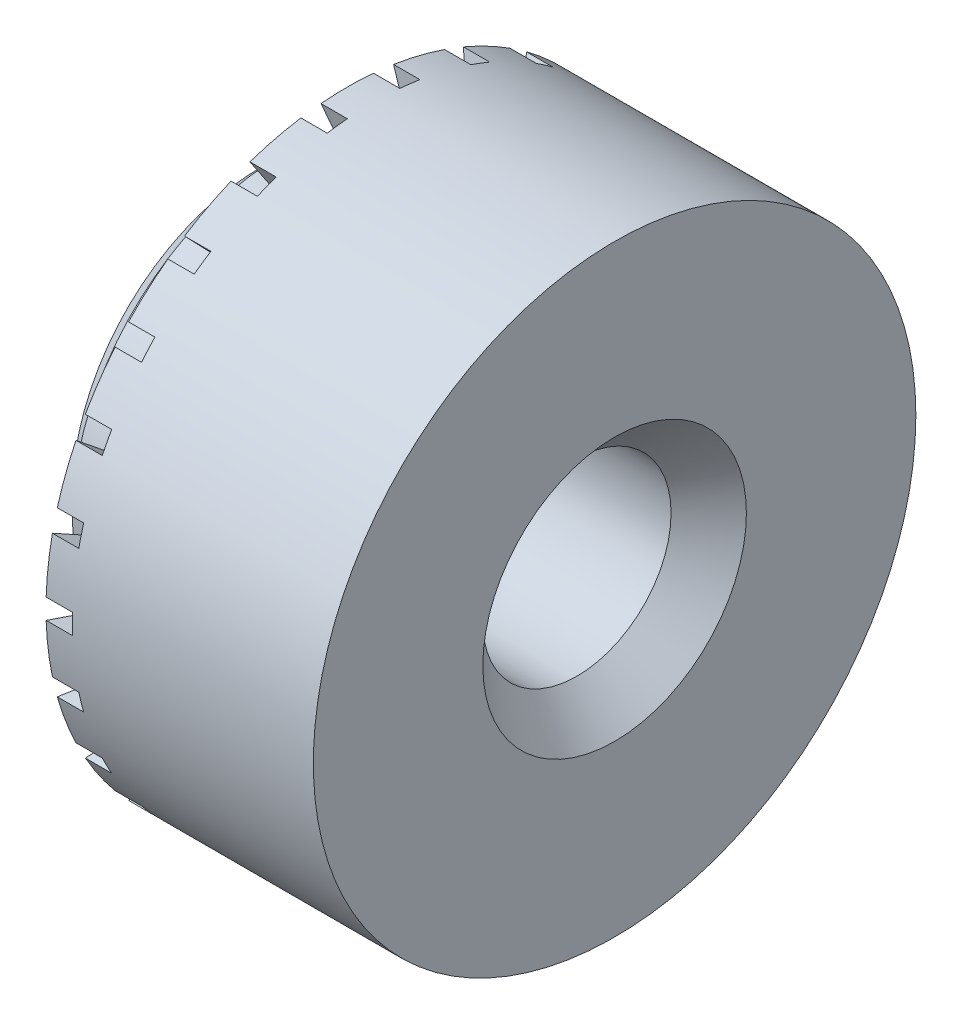
from build123d import *

# Parameters (mm, degrees)
SKETCH_1_R               = 4
EXTRUDE_1_DEPTH          = 3.2
SKETCH_2_R               = 2.75
EXTRUDE_2_DEPTH          = 1.5
SKETCH_3_R               = 1.25
CUT_EXTRUDE_1_DEPTH      = 8.354590403
CHAMFER_1_SIZE           = 0.5
CHAMFER_2_SIZE           = 0.25
REVOLVE_1_ANGLE          = 10
CUT_EXTRUDE_3_DEPTH      = 7.499230724
PATTERN_CIRCULAR_1_COUNT = 26


# Read off the part's stored shape, not the designer's step: Повернуть1
with BuildPart() as part:
    # Эскиз1 → Вытянуть1 (new body)
    with BuildSketch(Plane(origin=(0, 0, 0), x_dir=(0, 0, -1), z_dir=(1, 0, 0))):
        Circle(SKETCH_1_R)
    extrude(amount=EXTRUDE_1_DEPTH)

    # Эскиз2 → Вытянуть2 (add)
    with BuildSketch(Plane.ZY):
        with Locations(Location((0, 0, 0), (0, 0, 180))):
            Circle(SKETCH_2_R)
    extrude(amount=EXTRUDE_2_DEPTH)

    # Эскиз3 → Вырез-Вытянуть1 (cut, through all)
    with BuildSketch(Plane(origin=(3.2, 0, 0), x_dir=(0, 0, -1), z_dir=(1, 0, 0))):
        Circle(SKETCH_3_R)
    extrude(amount=-CUT_EXTRUDE_1_DEPTH, mode=Mode.SUBTRACT)

    # Фаска1
    chamfer_1_edges = [part.edges().sort_by_distance(p)[0] for p in [
        (-1.5, 0, 1.25),
        (3.2, 0, 1.25),
    ]]
    chamfer(chamfer_1_edges, length=CHAMFER_1_SIZE)

    # Фаска2
    chamfer_2_edges = [part.edges().sort_by_distance(p)[0] for p in [
        (-1.5, 0, 2.75),
    ]]
    chamfer(chamfer_2_edges, length=CHAMFER_2_SIZE)

    # Повернуть1 outline → Повернуть1 (revolve)
    with BuildSketch(Plane(origin=(0, 0, 0), x_dir=(0, 0.9961946980917455, -0.08715574274765835), z_dir=(0, -0.08715574274765835, -0.9961946980917455))):
        Polygon((4, 0), (2.75, 0), (4, -0.35), align=None)
    revolve(axis=Axis((0, 0, 0), (1, 0, 0)), revolution_arc=REVOLVE_1_ANGLE)

    # Эскиз5 → Вырез-Вытянуть3 (cut, through all)
    with BuildSketch(Plane.ZY):
        with BuildLine():
            Line((-0.239678293, 2.73953542), (-0.348622971, 3.984778792))
            ThreePointArc((-0.348622971, 3.984778792), (-0.350771772, 3.984590213), (-0.352920472, 3.984400474))
            Line((-0.352920472, 3.984400474), (-0.352920472, 2.727260006))
            ThreePointArc((-0.352920472, 2.727260006), (-0.296362945, 2.73398409), (-0.239678293, 2.73953542))
        make_face()
        with BuildLine():
            ThreePointArc((-0.239678293, 2.73953542), (-0.119953315, 2.747382609), (0, 2.75))
            Line((0, 2.75), (-0.348622971, 3.984778792))
            Line((-0.348622971, 3.984778792), (-0.239678293, 2.73953542))
        make_face()
        with BuildLine():
            Line((0.348622971, 3.984778792), (0, 2.75))
            ThreePointArc((0, 2.75), (0.119953315, 2.747382609), (0.239678293, 2.73953542))
            Line((0.239678293, 2.73953542), (0.348622971, 3.984778792))
        make_face()
        with BuildLine():
            ThreePointArc((0.352920472, 3.984400474), (0.350771772, 3.984590213), (0.348622971, 3.984778792))
            Line((0.348622971, 3.984778792), (0.239678293, 2.73953542))
            ThreePointArc((0.239678293, 2.73953542), (0.296362945, 2.73398409), (0.352920472, 2.727260006))
            Line((0.352920472, 2.727260006), (0.352920472, 3.984400474))
        make_face()
    extrude(amount=CUT_EXTRUDE_3_DEPTH, mode=Mode.SUBTRACT)

    # Круговой массив1: part ×26 about axis
    pattern_circular_1_axis = Axis((0, 0, 0), (1, 0, 0))


with BuildPart() as part_1:
    add(part.part)
    for i in range(1, PATTERN_CIRCULAR_1_COUNT):
        add(part.part.rotate(pattern_circular_1_axis, i * 360 / PATTERN_CIRCULAR_1_COUNT))


solid = part_1.part
